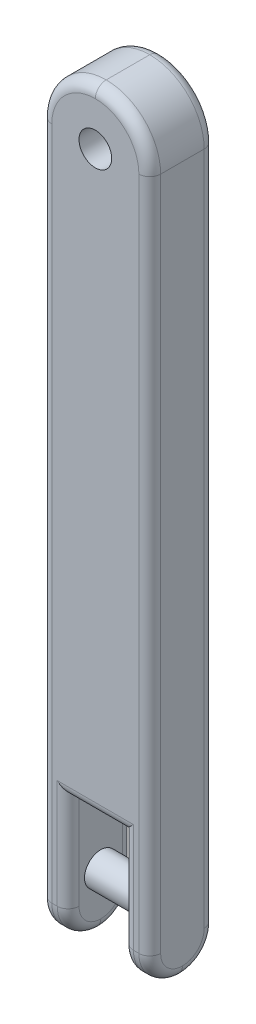
from build123d import *

# Parameters (mm, degrees)
CROQUIS1_R              = 7.5
SALIENTE_EXTRUIR2_DEPTH = 30
REDONDEO1_R             = 25
CROQUIS2_R              = 7.5
SALIENTE_EXTRUIR3_DEPTH = 50
REDONDEO2_R             = 5
REDONDEO4_R             = 15


# Some blends are built 0.0001 mm under size
with BuildPart() as part:
    # Croquis1 → Saliente-Extruir2 (new body)
    with BuildSketch(Plane.XY):
        Polygon((12.5, 0), (12.5, 60), (37.5, 60), (37.5, 0), (50, 0), (50, 350), (0, 350), (0, 0), align=None)
        with Locations((25, 325)):
            Circle(CROQUIS1_R, mode=Mode.SUBTRACT)
    extrude(amount=SALIENTE_EXTRUIR2_DEPTH)

    # Redondeo1
    redondeo1_edges = [part.edges().sort_by_distance(p)[0] for p in [
        (0, 350, 15),
        (50, 350, 15),
    ]]
    fillet(redondeo1_edges, radius=REDONDEO1_R - 0.0001)  # a hair under: the kernel refuses the full size

    # Croquis2 → Saliente-Extruir3 (add)
    with BuildSketch(Plane.ZY):
        with Locations((15, 25)):
            Circle(CROQUIS2_R)
    extrude(amount=-SALIENTE_EXTRUIR3_DEPTH)

    # Redondeo2
    redondeo2_edges = [part.edges().sort_by_distance(p)[0] for p in [
        (12.5, 30, 30),
        (25, 60, 30),
        (50, 0, 15),
        (37.5, 0, 15),
        (12.5, 0, 15),
        (0, 0, 15),
        (37.5, 30, 30),
        (50, 162.50005, 30),
        (0, 162.50005, 0),
        (0, 162.50005, 30),
        (42.677698819, 342.677698819, 0),
        (7.322301181, 342.677698819, 0),
        (42.677698819, 342.677698819, 30),
        (7.322301181, 342.677698819, 30),
        (50, 162.50005, 0),
        (37.5, 30, 0),
        (25, 60, 0),
        (12.5, 30, 0),
    ]]
    fillet(redondeo2_edges, radius=REDONDEO2_R)

    # Redondeo4
    # the kernel refuses this fillet: 15 mm, written as the material it takes off along each edge
    with BuildSketch(Plane(origin=(50, 15, 15), x_dir=(0, -1, 0), z_dir=(0, 0, 1))) as redondeo4_piece_1:
        with BuildLine():
            CenterArc((10, -5), 5, 0, 90)
            Line((15, -5), (15, 0))
            Line((15, 0), (10, 0))
        make_face()
    revolve(axis=Axis((50, 15, 15), (1, 0, 0)), revolution_arc=90, mode=Mode.SUBTRACT)
    with BuildSketch(Plane(origin=(37.5, 15, 15), x_dir=(0, 0, -1), z_dir=(0, 1, 0))) as redondeo4_piece_2:
        with BuildLine():
            CenterArc((10, -5), 5, 0, 90)
            Line((15, -5), (15, 0))
            Line((15, 0), (10, 0))
        make_face()
    revolve(axis=Axis((37.5, 15, 15), (-1, 0, 0)), revolution_arc=90, mode=Mode.SUBTRACT)
    with BuildSketch(Plane(origin=(12.5, 15, 15), x_dir=(0, -1, 0), z_dir=(0, 0, 1))) as redondeo4_piece_3:
        with BuildLine():
            CenterArc((10, -5), 5, 0, 90)
            Line((15, -5), (15, 0))
            Line((15, 0), (10, 0))
        make_face()
    revolve(axis=Axis((12.5, 15, 15), (1, 0, 0)), revolution_arc=90, mode=Mode.SUBTRACT)
    with BuildSketch(Plane(origin=(0, 15, 15), x_dir=(0, 0, -1), z_dir=(0, 1, 0))) as redondeo4_piece_4:
        with BuildLine():
            CenterArc((10, -5), 5, 0, 90)
            Line((15, -5), (15, 0))
            Line((15, 0), (10, 0))
        make_face()
    revolve(axis=Axis((0, 15, 15), (-1, 0, 0)), revolution_arc=90, mode=Mode.SUBTRACT)
    with BuildSketch(Plane(origin=(12.5, 15, 15), x_dir=(0, 0, 1), z_dir=(0, 1, 0))) as redondeo4_piece_5:
        with BuildLine():
            CenterArc((10, -5), 5, 0, 90)
            Line((15, -5), (15, 0))
            Line((15, 0), (10, 0))
        make_face()
    revolve(axis=Axis((12.5, 15, 15), (1, 0, 0)), revolution_arc=90, mode=Mode.SUBTRACT)
    with BuildSketch(Plane(origin=(0, 15, 15), x_dir=(0, -1, 0), z_dir=(0, 0, -1))) as redondeo4_piece_6:
        with BuildLine():
            CenterArc((10, -5), 5, 0, 90)
            Line((15, -5), (15, 0))
            Line((15, 0), (10, 0))
        make_face()
    revolve(axis=Axis((0, 15, 15), (-1, 0, 0)), revolution_arc=90, mode=Mode.SUBTRACT)
    with BuildSketch(Plane(origin=(50, 15, 15), x_dir=(0, 0, 1), z_dir=(0, 1, 0))) as redondeo4_piece_7:
        with BuildLine():
            CenterArc((10, -5), 5, 0, 90)
            Line((15, -5), (15, 0))
            Line((15, 0), (10, 0))
        make_face()
    revolve(axis=Axis((50, 15, 15), (1, 0, 0)), revolution_arc=90, mode=Mode.SUBTRACT)
    with BuildSketch(Plane(origin=(37.5, 15, 15), x_dir=(0, -1, 0), z_dir=(0, 0, -1))) as redondeo4_piece_8:
        with BuildLine():
            CenterArc((10, -5), 5, 0, 90)
            Line((15, -5), (15, 0))
            Line((15, 0), (10, 0))
        make_face()
    revolve(axis=Axis((37.5, 15, 15), (-1, 0, 0)), revolution_arc=90, mode=Mode.SUBTRACT)
    with BuildSketch(Plane(origin=(37.5, 0, 30), x_dir=(0, 1, 0), z_dir=(1, 0, 0)), Plane(origin=(0, 0, 30), x_dir=(0, 1, 0), z_dir=(1, 0, 0))) as redondeo4_piece_9:
        with BuildLine():
            CenterArc((REDONDEO4_R, -REDONDEO4_R), REDONDEO4_R, 90, 90)
            Line((0, -REDONDEO4_R), (0, 0))
            Line((0, 0), (REDONDEO4_R, 0))
        make_face()
    extrude(amount=12.5, mode=Mode.SUBTRACT)
    with BuildSketch(Plane(origin=(0, 0, 0), x_dir=(0, 1, 0), z_dir=(1, 0, 0)), Plane(origin=(37.5, 0, 0), x_dir=(0, 1, 0), z_dir=(1, 0, 0))) as redondeo4_piece_10:
        with BuildLine():
            CenterArc((REDONDEO4_R, REDONDEO4_R), REDONDEO4_R, 180, 90)
            Line((0, REDONDEO4_R), (0, 0))
            Line((0, 0), (REDONDEO4_R, 0))
        make_face()
    extrude(amount=12.5, mode=Mode.SUBTRACT)


solid = part.part
